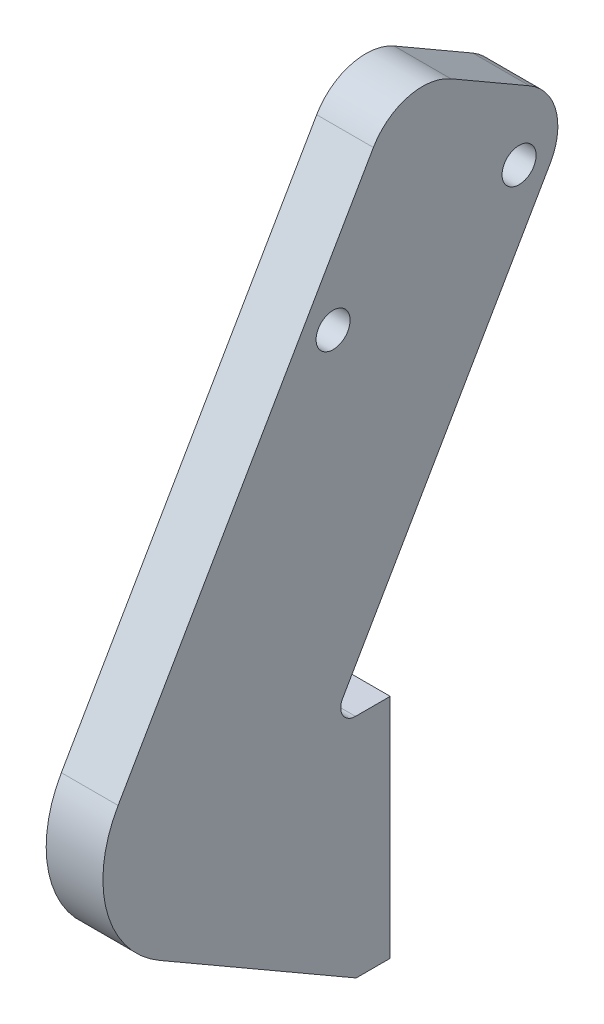
from build123d import *

# Parameters (mm, degrees)
SKETCH_1_W          = 17
SKETCH_1_H          = 20
SKETCH_1_R          = 1.5
EXTRUDE_1_DEPTH     = 3
EXTRUDE_2_DEPTH     = 5
SKETCH_4_R          = 1.5
CUT_EXTRUDE_1_DEPTH = 5
FILLET_2_R          = 5
FILLET_3_R          = 1.3
FILLET_4_R          = 10
SKETCH_5_W          = 6
SKETCH_5_H          = 20
CUT_EXTRUDE_2_DEPTH = 10


with BuildPart() as part:
    # 草图1 → 凸台-拉伸1 (new body)
    with BuildSketch(Plane.XY):
        with Locations((8.5, 10)):
            Rectangle(SKETCH_1_W, SKETCH_1_H)
        with Locations((3, 16.25)):
            Circle(SKETCH_1_R, mode=Mode.SUBTRACT)
        with Locations((14, 16.25)):
            Circle(SKETCH_1_R, mode=Mode.SUBTRACT)
        with Locations((14, 3.75)):
            Circle(SKETCH_1_R, mode=Mode.SUBTRACT)
        with Locations((3, 3.75)):
            Circle(SKETCH_1_R, mode=Mode.SUBTRACT)
    extrude(amount=EXTRUDE_1_DEPTH)

    # 草图3 → 凸台-拉伸2 (add)
    with BuildSketch(Plane.ZY.offset(-6)):
        Polygon((3, 20), (5.309401077, 20), (-16.607695155, 57.961524227), (-1.019237886, 66.961524227), (28.980762114, 15), (3, 0), align=None)
    extrude(amount=-EXTRUDE_2_DEPTH)

    # 草图4 → 切除-拉伸1 (cut)
    with BuildSketch(Plane(origin=(11, 0, 0), x_dir=(0, 0, -1), z_dir=(1, 0, 0))):
        with Locations((-5.032685902, 50.479284742)):
            Circle(SKETCH_4_R)
        with Locations((11.359618943, 54.871589587)):
            Circle(SKETCH_4_R)
    extrude(amount=-CUT_EXTRUDE_1_DEPTH, mode=Mode.SUBTRACT)

    # 圆角2
    fillet_2_edges = [part.edges().sort_by_distance(p)[0] for p in [
        (8.5, 66.961524227, -1.019237886),
        (8.5, 57.961524227, -16.607695155),
    ]]
    fillet(fillet_2_edges, radius=FILLET_2_R)

    # 圆角3
    fillet_3_edges = [part.edges().sort_by_distance(p)[0] for p in [
        (8.5, 20, 5.309401077),
    ]]
    fillet(fillet_3_edges, radius=FILLET_3_R)

    # 圆角4
    fillet_4_edges = [part.edges().sort_by_distance(p)[0] for p in [
        (8.5, 15, 28.980762114),
    ]]
    fillet(fillet_4_edges, radius=FILLET_4_R)

    # 草图5 → 切除-拉伸2 (cut)
    with BuildSketch(Plane.XY.offset(3)):
        with Locations((14, 10)):
            Rectangle(SKETCH_5_W, SKETCH_5_H)
    extrude(amount=-CUT_EXTRUDE_2_DEPTH, mode=Mode.SUBTRACT)


solid = part.part
